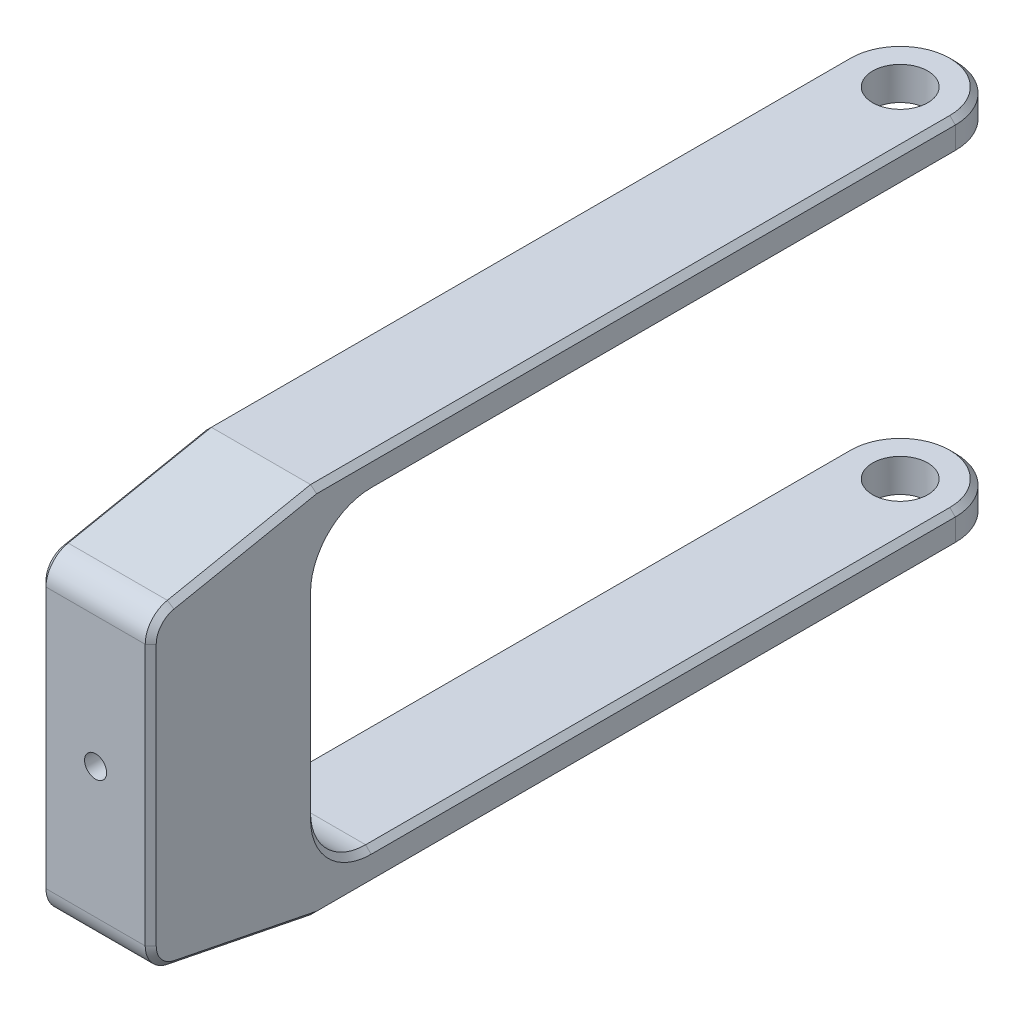
from build123d import *

# Parameters (mm, degrees)
EXTRUDE_2_DEPTH     = 33.8
SKETCH_2_W          = 63
SKETCH_2_H          = 27.8
CUT_EXTRUDE_2_DEPTH = 73.190304058
SKETCH_4_W          = 15
SKETCH_4_H          = 13.9
EXTRUDE_4_DEPTH     = 10
FILLET_1_R          = 5
FILLET_2_R          = 5
FILLET_3_R          = 2.5
SKETCH_5_R          = 2.5
CUT_EXTRUDE_3_DEPTH = 72.668961204
SKETCH_6_R          = 1
CUT_EXTRUDE_4_DEPTH = 72.668961204
CHAMFER_2_SIZE      = 0.5


with BuildPart() as part:
    # ｽｹｯﾁ1 → ﾎﾞｽ - 押し出し2 (new body)
    with BuildSketch(Plane(origin=(0, 0, 0), x_dir=(1, 0, 0), z_dir=(0, 1, 0))):
        with BuildLine():
            Line((-5, 0), (0, 0))
            Line((0, 0), (0, 58))
            Line((0, 58), (0, 63))
            ThreePointArc((0, 63), (-3.535533906, 61.535533906), (-5, 58))
            Line((-5, 58), (-5, 0))
        make_face()
        with BuildLine():
            Line((0, 58), (0, 0))
            Line((0, 0), (5, 0))
            Line((5, 0), (5, 58))
            ThreePointArc((5, 58), (3.535533906, 61.535533906), (0, 63))
            Line((0, 63), (0, 58))
        make_face()
        with BuildLine():
            ThreePointArc((-5, 58), (-3.535533906, 61.535533906), (0, 63))
            Line((0, 63), (-5, 63))
            Line((-5, 63), (-5, 58))
        make_face()
        with BuildLine():
            Line((5, 63), (0, 63))
            ThreePointArc((0, 63), (3.535533906, 61.535533906), (5, 58))
            Line((5, 58), (5, 63))
        make_face()
    extrude(amount=EXTRUDE_2_DEPTH)

    # ｽｹｯﾁ2 → ｶｯﾄ - 押し出し2 (cut, through all)
    with BuildSketch(Plane.ZY.offset(5)):
        with Locations((-31.5, 16.9)):
            Rectangle(SKETCH_2_W, SKETCH_2_H)
    extrude(amount=-CUT_EXTRUDE_2_DEPTH, mode=Mode.SUBTRACT)


with BuildPart() as cut_extrude_2_piece_1:
    # of the separate pieces the step leaves, piece 1, a body of its own (cut_extrude_2_pieces)
    add(part.part.solids().sort_by_distance((-5, 30.8, 0))[0])



with BuildPart() as cut_extrude_2_piece_2:
    # of the separate pieces the step leaves, piece 2, a body of its own (cut_extrude_2_pieces)
    add(part.part.solids().sort_by_distance((-5, 0, 0))[0])


with BuildPart() as cut_extrude_2_piece_1_1:
    add(cut_extrude_2_piece_1.part)

    add(cut_extrude_2_piece_2.part)  # ﾎﾞｽ - 押し出し4 merges ｶｯﾄ - 押し出し2 piece 2
    # ｽｹｯﾁ4 → ﾎﾞｽ - 押し出し4 (add)
    with BuildSketch(Plane.ZY.offset(5)):
        Polygon((0, 3), (0, 0), (15, 3), align=None)
        with Locations((7.5, 9.95)):
            Rectangle(SKETCH_4_W, SKETCH_4_H)
        with Locations((7.5, 23.85)):
            Rectangle(SKETCH_4_W, SKETCH_4_H)
        Polygon((0, 33.8), (0, 30.8), (15, 30.8), align=None)
    extrude(amount=-EXTRUDE_4_DEPTH)

    # ﾌｨﾚｯﾄ1
    fillet_1_edges = [cut_extrude_2_piece_1_1.edges().sort_by_distance(p)[0] for p in [
        (5, 1.5, -63),
        (-5, 1.5, -63),
        (5, 32.3, -63),
        (-5, 32.3, -63),
    ]]
    fillet(fillet_1_edges, radius=FILLET_1_R - 0.0001)  # a hair under: the kernel refuses the full size

    # ﾌｨﾚｯﾄ2
    fillet_2_edges = [cut_extrude_2_piece_1_1.edges().sort_by_distance(p)[0] for p in [
        (0, 30.8, 0),
        (0, 3, 0),
    ]]
    fillet(fillet_2_edges, radius=FILLET_2_R)

    # ﾌｨﾚｯﾄ3
    fillet_3_edges = [cut_extrude_2_piece_1_1.edges().sort_by_distance(p)[0] for p in [
        (0, 30.8, 15),
        (0, 3, 15),
    ]]
    fillet(fillet_3_edges, radius=FILLET_3_R)

    # ｽｹｯﾁ5 → ｶｯﾄ - 押し出し3 (cut, through all)
    with BuildSketch(Plane(origin=(0, 33.8, 0), x_dir=(1, 0, 0), z_dir=(0, 1, 0))):
        with Locations(Location((0, 58, 0), (0, 0, 270))):
            Circle(SKETCH_5_R)
    extrude(amount=-CUT_EXTRUDE_3_DEPTH, mode=Mode.SUBTRACT)

    # ｽｹｯﾁ6 → ｶｯﾄ - 押し出し4 (cut, through all)
    with BuildSketch(Plane(origin=(0, 0, 0), x_dir=(-1, 0, 0), z_dir=(0, 0, -1))):
        with Locations((0, 16.9)):
            Circle(SKETCH_6_R)
    extrude(amount=-CUT_EXTRUDE_4_DEPTH, mode=Mode.SUBTRACT)

    # 面取り2
    chamfer_2_edges = [cut_extrude_2_piece_1_1.edges().sort_by_distance(p)[0] for p in [
        (-5, 1.299029034, 6.495145169),
        (5, 32.500970966, 6.495145169),
        (5, 33.8, -29.00005),
        (5, 0, -29.00005),
        (-5, 0, -29.00005),
        (-3.535563195, 0, -61.535563195),
        (3.535563195, 0, -61.535563195),
        (5, 30.8, -31.50005),
        (5, 3, -31.50005),
        (-5, 3, -31.50005),
        (-3.535563195, 3, -61.535563195),
        (3.535563195, 3, -61.535563195),
        (-5, 30.8, -31.50005),
        (-5, 33.8, -29.00005),
        (-3.535563195, 30.8, -61.535563195),
        (3.535563195, 30.8, -61.535563195),
        (-3.535563195, 33.8, -61.535563195),
        (3.535563195, 33.8, -61.535563195),
        (-5, 16.9, 0),
        (5, 16.9, 0),
        (-5, 29.335533906, -1.464466094),
        (5, 29.335533906, -1.464466094),
        (-5, 4.464466094, -1.464466094),
        (5, 4.464466094, -1.464466094),
        (5, 16.9, 15),
        (-5, 16.9, 15),
        (-5, 32.500970966, 6.495145169),
        (-5, 3.464537493, 14.433355353),
        (-5, 30.335462507, 14.433355353),
        (5, 1.299029034, 6.495145169),
        (5, 3.464537493, 14.433355353),
        (5, 30.335462507, 14.433355353),
    ]]
    chamfer(chamfer_2_edges, length=CHAMFER_2_SIZE)


solid = cut_extrude_2_piece_1_1.part
